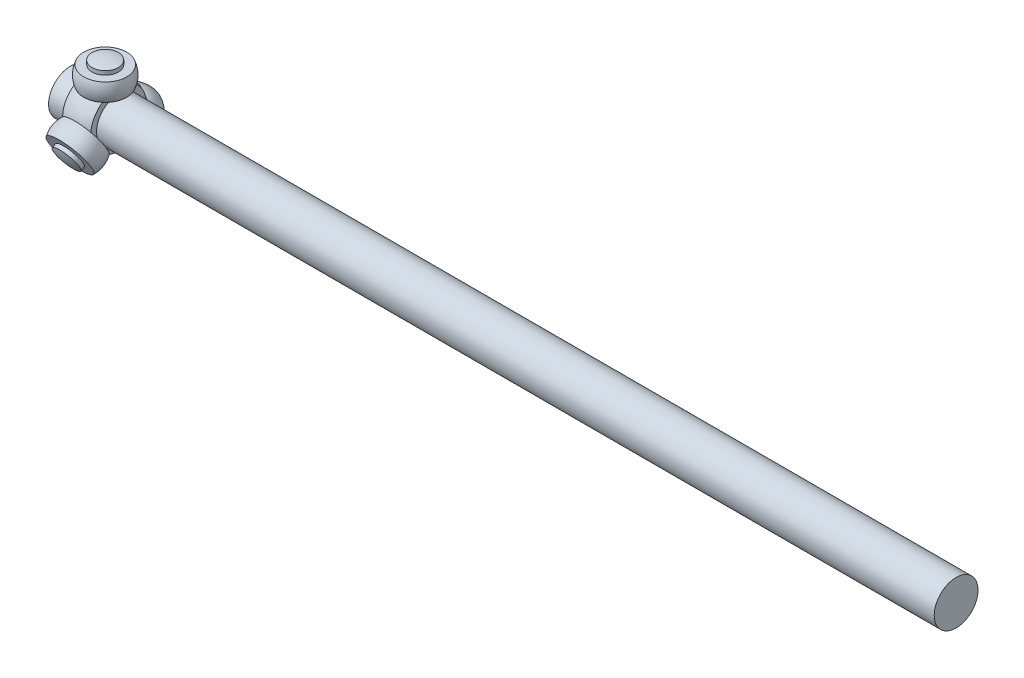
from build123d import *

# Parameters (mm, degrees)
CUT_EXTRUDE1_DEPTH       = 31.174758882
BOSS_EXTRUDE1_START      = 13.11
BOSS_EXTRUDE1_OUTLINE_R  = 7.478502705
BOSS_EXTRUDE1_DEPTH      = 10.08
CIRPATTERN1_COUNT        = 3
BOSS_EXTRUDE2_DEPTH      = 10.08
BOSS_EXTRUDE2_DEPTH_BACK = 495
SKETCH6_R                = 12.5


# Read off the part's stored shape, not the designer's step: Boss-Extrude1, Revolve3
with BuildPart() as part:
    # Sketch1 → Revolve1 (revolve)
    with BuildSketch(Plane.XY):
        with BuildLine():
            Line((-9.722222222, 14.550889837), (-9.722222222, 12.5))
            Line((-9.722222222, 12.5), (7.540919832, 12.5))
            Line((7.540919832, 12.5), (7.540919832, 15.791913376))
            ThreePointArc((7.540919832, 15.791913376), (-1.254812689, 17.454954744), (-9.722222222, 14.550889837))
        make_face()
    revolve(axis=Axis((-47.061566383, 0, 0), (1, 0, 0)))

    # Sketch2 → Cut-Extrude1 (cut, symmetric)
    with BuildSketch(Plane(origin=(7.540919832, 0, 0), x_dir=(0, 0, -1), z_dir=(1, 0, 0))):
        Polygon((-17.183661108, 13.11), (20.1337897, 13.11), (18.772985043, 23.764289573), (-17.183661108, 23.764289573), align=None)
    cut_extrude1 = extrude(amount=CUT_EXTRUDE1_DEPTH, both=True, mode=Mode.SUBTRACT)

    # Boss-Extrude1 outline → Boss-Extrude1 (add)
    with BuildSketch(Plane(origin=(0, 0, 0), x_dir=(1, 0, 0), z_dir=(0, 1, 0)).offset(BOSS_EXTRUDE1_START)):
        Circle(BOSS_EXTRUDE1_OUTLINE_R)
    boss_extrude1 = extrude(amount=BOSS_EXTRUDE1_DEPTH)

    # Sketch4 → Revolve2 (revolve)
    with BuildSketch(Plane(origin=(0, 0, 0), x_dir=(0, 0, -1), z_dir=(1, 0, 0)), mode=Mode.PRIVATE) as revolve2_sk:
        with BuildLine():
            Line((7.478502705, 25.422863672), (7.478502705, 23.19))
            Line((7.478502705, 23.19), (0, 23.19))
            Line((0, 23.19), (0, 26.5))
            ThreePointArc((0, 26.5), (3.777837522, 26.229333649), (7.478502705, 25.422863672))
        make_face()
    revolve2 = revolve(revolve2_sk.sketch.rotate(Axis((0, 0, 0), (0, 1, 0)), 180), axis=Axis((0, 0, 0), (0, 1, 0)))

    # Revolve3 outline → Revolve3 (revolve)
    with BuildSketch(Plane.XY):
        with BuildLine():
            Line((7.478502705, 23.190000012), (7.478502705, 13.109999988))
            Line((7.478502705, 13.109999988), (12.254015665, 13.109999994))
            ThreePointArc((12.254015665, 13.109999994), (13.25, 18.15), (12.254015665, 23.190000006))
            Line((12.254015665, 23.190000006), (7.478502705, 23.190000012))
        make_face()
    revolve3 = revolve(axis=Axis((0, 0, 0), (0, 1, 0)))

    # CirPattern1: Cut-Extrude1, Boss-Extrude1, Revolve2, Revolve3 ×3 about axis
    cirpattern1_axis = Axis((0, 0, 0), (1, 0, 0))
    add([cut_extrude1.rotate(cirpattern1_axis, i * 360 / CIRPATTERN1_COUNT) for i in range(1, CIRPATTERN1_COUNT)], mode=Mode.SUBTRACT)
    add([boss_extrude1.rotate(cirpattern1_axis, i * 360 / CIRPATTERN1_COUNT) for i in range(1, CIRPATTERN1_COUNT)])
    add([revolve2.rotate(cirpattern1_axis, i * 360 / CIRPATTERN1_COUNT) for i in range(1, CIRPATTERN1_COUNT)])
    add([revolve3.rotate(cirpattern1_axis, i * 360 / CIRPATTERN1_COUNT) for i in range(1, CIRPATTERN1_COUNT)])

    # Sketch6 → Boss-Extrude2 (add, two sides: drawn at the far end of the back side and taken through both)
    with BuildSketch(Plane.ZY.offset(9.722222222).offset(-BOSS_EXTRUDE2_DEPTH_BACK)):
        Circle(SKETCH6_R)
    extrude(amount=BOSS_EXTRUDE2_DEPTH + BOSS_EXTRUDE2_DEPTH_BACK)


solid = part.part
